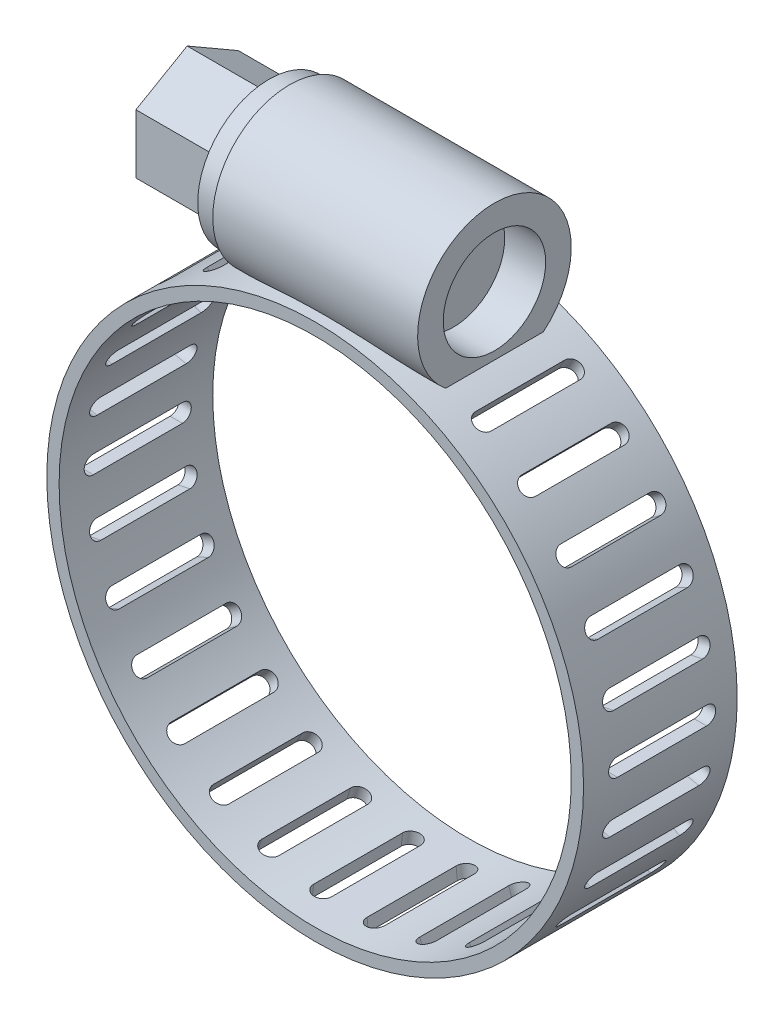
from build123d import *

# Parameters (mm, degrees)
SKETCH1_R           = 16.637
SKETCH1_R_2         = 15.875
BOSS_EXTRUDE1_DEPTH = 9.525
CUT_EXTRUDE1_DEPTH  = 26.383166922
CIRPATTERN1_COUNT   = 30
SKETCH3_R           = 4.7625
BOSS_EXTRUDE2_DEPTH = 6.35
BOSS_EXTRUDE3_DEPTH = 6.35
SKETCH5_R           = 4.424890591
BOSS_EXTRUDE4_DEPTH = 1.27
SKETCH6_R           = 3.175
CUT_EXTRUDE2_DEPTH  = 2.54


with BuildPart() as part:
    # Sketch1 → Boss-Extrude1 (new body)
    with BuildSketch(Plane.XY):
        Circle(SKETCH1_R)
        Circle(SKETCH1_R_2, mode=Mode.SUBTRACT)
    extrude(amount=BOSS_EXTRUDE1_DEPTH)

    # Sketch2 → Cut-Extrude1 (cut, through all)
    with BuildSketch(Plane(origin=(0, 0, 0), x_dir=(0, 0, -1), z_dir=(1, 0, 0))):
        with BuildLine():
            Line((-7.410641086, 0.559466427), (-1.890572344, 0.559466427))
            ThreePointArc((-1.890572344, 0.559466427), (-1.331105917, 0), (-1.890572344, -0.559466427))
            Line((-1.890572344, -0.559466427), (-7.410641086, -0.559466427))
            ThreePointArc((-7.410641086, -0.559466427), (-7.970107512, 0), (-7.410641086, 0.559466427))
        make_face()
    cut_extrude1 = extrude(amount=-CUT_EXTRUDE1_DEPTH, mode=Mode.SUBTRACT)

    # CirPattern1: Cut-Extrude1 ×30 about axis
    cirpattern1_axis = Axis((0, 0, 9.525), (0, 0, -1))
    for i in range(1, CIRPATTERN1_COUNT):
        add(cut_extrude1.rotate(cirpattern1_axis, i * 360 / CIRPATTERN1_COUNT), mode=Mode.SUBTRACT)

    # Sketch3 → Boss-Extrude2 (add, symmetric)
    with BuildSketch(Plane(origin=(0, 0, 0), x_dir=(0, 0, -1), z_dir=(1, 0, 0))):
        with Locations((-4.7625, 19.05)):
            Circle(SKETCH3_R)
    extrude(amount=BOSS_EXTRUDE2_DEPTH, both=True)

    # Sketch4 → Boss-Extrude3 (add)
    with BuildSketch(Plane.ZY.offset(6.35)):
        Polygon((4.7625, 22.716174209), (1.5875, 20.883087105), (1.5875, 17.216912895), (4.7625, 15.383825791), (7.9375, 17.216912895), (7.9375, 20.883087105), align=None)
    extrude(amount=BOSS_EXTRUDE3_DEPTH)

    # Sketch5 → Boss-Extrude4 (add)
    with BuildSketch(Plane.ZY.offset(6.35)):
        with Locations((4.7625, 19.05)):
            Circle(SKETCH5_R)
    extrude(amount=BOSS_EXTRUDE4_DEPTH)

    # Sketch6 → Cut-Extrude2 (cut)
    with BuildSketch(Plane(origin=(6.35, 0, 0), x_dir=(0, 0, -1), z_dir=(1, 0, 0))):
        with Locations((-4.7625, 19.05)):
            Circle(SKETCH6_R)
    extrude(amount=-CUT_EXTRUDE2_DEPTH, mode=Mode.SUBTRACT)


solid = part.part
